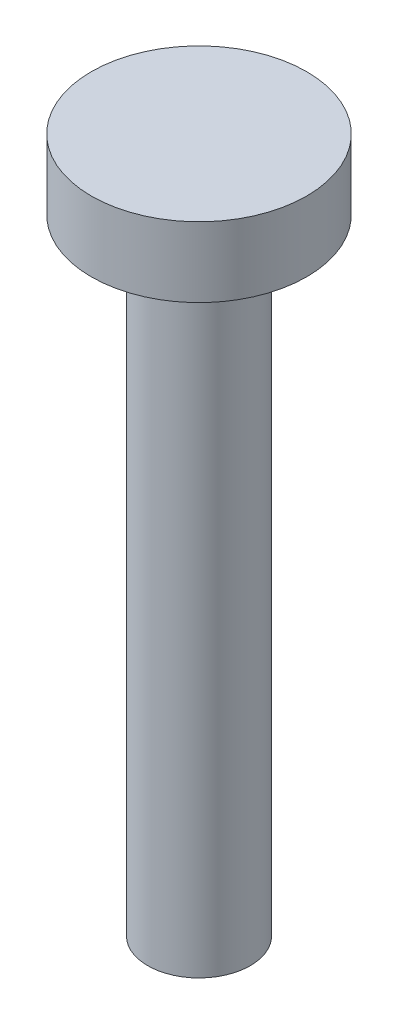
from build123d import *


with BuildPart() as part:
    # Sketch1 → Revolve1 (revolve)
    with BuildSketch(Plane.XY):
        Polygon((0, 0), (4.7625, 0), (4.7625, 58), (10, 58), (10, 64.5), (0, 64.5), align=None)
    revolve(axis=Axis((0, 0, 0), (0, 1, 0)))


solid = part.part
